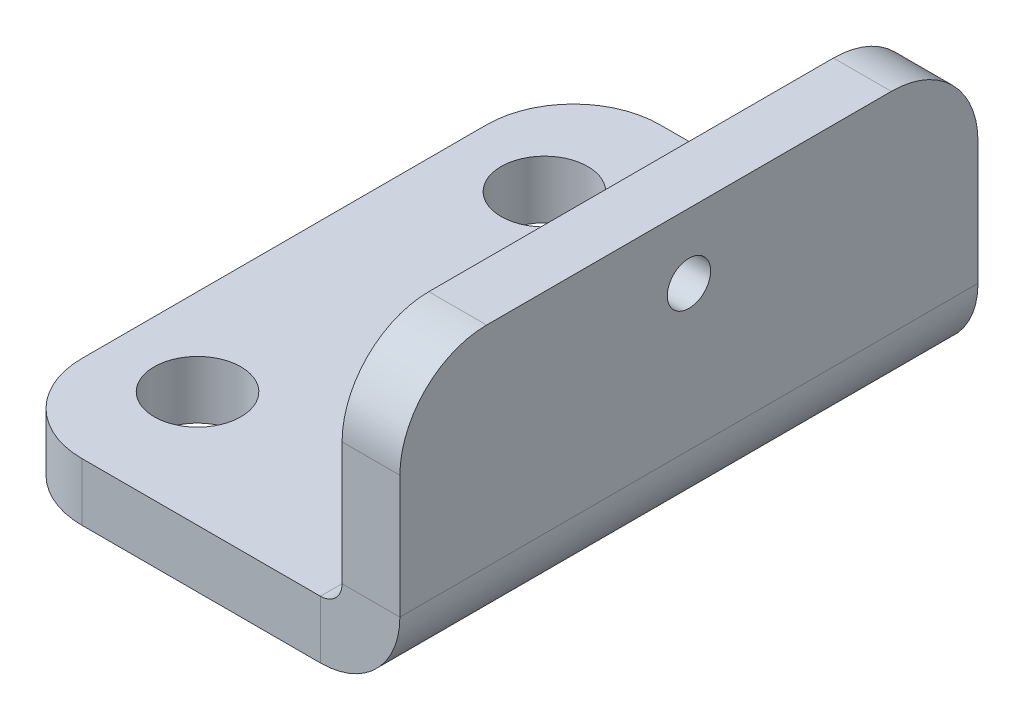
from build123d import *

# Parameters (mm, degrees)
BASE_FLANGE1_DEPTH = 10
FILLET1_R          = 3
SKETCH6_R          = 1.5
CUT_EXTRUDE1_DEPTH = 18.549928775
SKETCH7_R          = 0.75
CUT_EXTRUDE2_DEPTH = 18.549928775


# Sheet-metal steps are written as plain solids
with BuildPart() as part:
    # Sketch1 → Base-Flange1 (new, symmetric)
    with BuildSketch(Plane.XY):
        with BuildLine():
            Line((-12, 0), (-0.75, 0))
            ThreePointArc((-0.75, 0), (-0.219669914, 0.219669914), (0, 0.75))
            Line((0, 0.75), (0, 8))
            Line((0, 8), (2, 8))
            Line((2, 8), (2, 0.75))
            ThreePointArc((2, 0.75), (1.194543648, -1.194543648), (-0.75, -2))
            Line((-0.75, -2), (-12, -2))
            Line((-12, -2), (-12, 0))
        make_face()
    extrude(amount=BASE_FLANGE1_DEPTH, both=True)

    # Fillet1
    fillet1_edges = [part.edges().sort_by_distance(p)[0] for p in [
        (-12, -1, 10),
        (-12, -1, -10),
        (1, 8, 10),
        (1, 8, -10),
    ]]
    fillet(fillet1_edges, radius=FILLET1_R)

    # Sketch6 → Cut-Extrude1 (cut, through all)
    with BuildSketch(Plane(origin=(0, 0, 0), x_dir=(1, 0, 0), z_dir=(0, 1, 0))):
        with Locations(Location((-9, 6, 0), (0, 0, 270))):
            Circle(SKETCH6_R)
        with Locations(Location((-9, -6, 0), (0, 0, 90))):
            Circle(SKETCH6_R)
    extrude(amount=-CUT_EXTRUDE1_DEPTH, mode=Mode.SUBTRACT)

    # Sketch7 → Cut-Extrude2 (cut, through all)
    with BuildSketch(Plane.ZY):
        with Locations((0, 5.75)):
            Circle(SKETCH7_R)
    extrude(amount=-CUT_EXTRUDE2_DEPTH, mode=Mode.SUBTRACT)


solid = part.part
